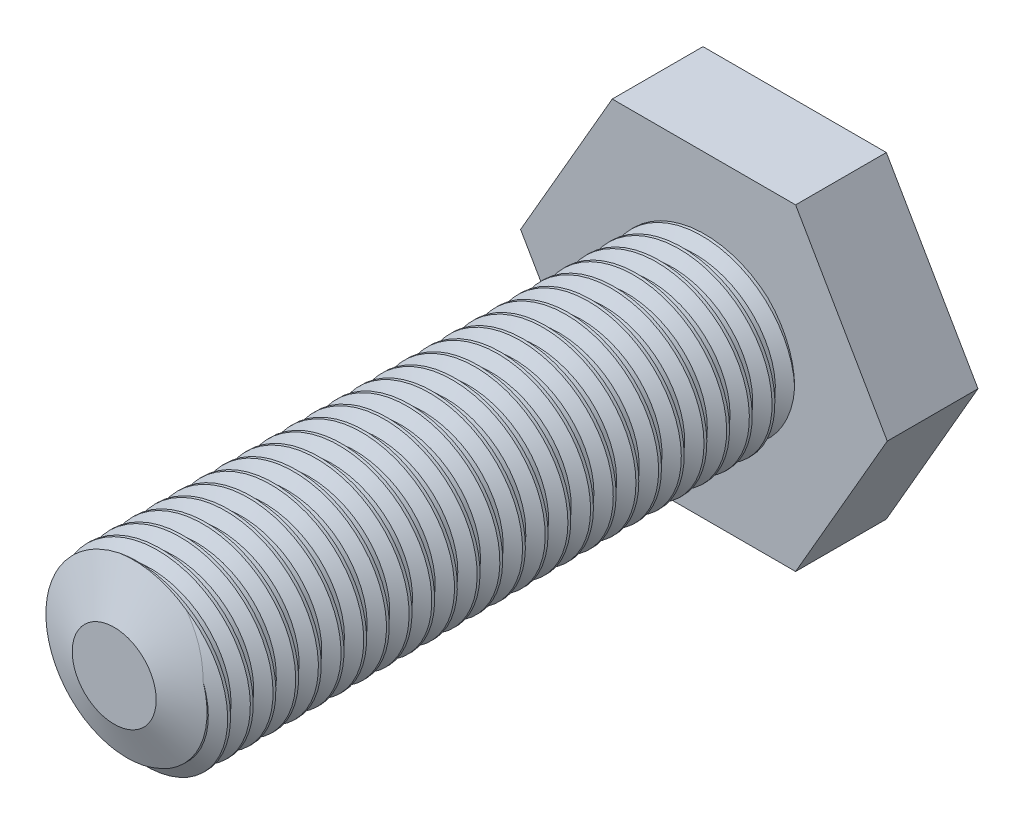
from build123d import *

# Parameters (mm, degrees)
BOSS_EXTRUDE1_DEPTH = 30
SKETCH3_OUTSIDE_W   = 25.534
SKETCH3_OUTSIDE_H   = 23.368
SKETCH3_OUTSIDE_R   = 4
CUT_EXTRUDE1_DEPTH  = 26
THREAD1_PITCH       = 1
THREAD1_FROM        = 1


with BuildPart() as part:
    # Sketch1 → Boss-Extrude1 (new body)
    with BuildSketch(Plane.XY):
        Polygon((-4.041451884, 7), (-8.082903769, 0), (-4.041451884, -7), (4.041451884, -7), (8.082903769, 0), (4.041451884, 7), align=None)
    extrude(amount=BOSS_EXTRUDE1_DEPTH)

    # Sketch3 outside → Cut-Extrude1 (cut)
    with BuildSketch(Plane.XY.offset(30)):
        Rectangle(SKETCH3_OUTSIDE_W, SKETCH3_OUTSIDE_H)
        Circle(SKETCH3_OUTSIDE_R, mode=Mode.SUBTRACT)
    extrude(amount=-CUT_EXTRUDE1_DEPTH, mode=Mode.SUBTRACT)

    # Thread1: arcs per turn and ends read off the stored shape
    # Thread1: the profile of Thread Profile1 profile screwed along a right-hand helix through 27 turns, 8 arcs to a turn; built about Z, then put on its axis
    thread1_z = Axis((0, 0, 0), (0, 0, 1))
    thread1_corners = [(4.0003, 0, -0.000173205), (4.0003, 0, 0.875173202), (3.458734125, 0, 0.562499999), (3.458734125, 0, 0.312499999)]
    with BuildLine(mode=Mode.PRIVATE) as thread1_profile:
        Line(thread1_corners[0], thread1_corners[1])
        Line(thread1_corners[1], thread1_corners[2])
        Line(thread1_corners[2], thread1_corners[3])
        Line(thread1_corners[3], thread1_corners[0])
    thread1_cap = Face(thread1_profile.wire())
    thread1_turn_angles = [0, 22.5, 45, 67.5, 90, 112.5, 135, 157.5, 180, 202.5, 225, 247.5, 270, 292.5, 315, 337.5, 360]
    thread1_turn_weights = [1, 0.9238795325112867, 1, 0.9238795325112867, 1, 0.9238795325112867, 1, 0.9238795325112867, 1, 0.9238795325112867, 1, 0.9238795325112867, 1, 0.9238795325112867, 1, 0.9238795325112867, 1]
    thread1_turn_rails = [Edge.make_bspline([Vector(p[0], p[1], 0).rotate(thread1_z, thread1_turn_angles[k]) / thread1_turn_weights[k] + Vector(0, 0, p[2] + THREAD1_PITCH * thread1_turn_angles[k] / 360) for k in range(17)], [0, 0, 0, 1, 1, 2, 2, 3, 3, 4, 4, 5, 5, 6, 6, 7, 7, 8, 8, 8], 2, thread1_turn_weights) for p in thread1_corners]
    thread1_turn_sides = [Face.make_surface_from_curves(thread1_turn_rails[p[0]], thread1_turn_rails[p[1]]) for p in [(0, 1), (1, 2), (2, 3), (3, 0)]]
    thread1 = Plane(origin=(0, 0, 3), x_dir=(1, 0, 0), z_dir=(0, 0, 1)) * split(Solid(Shell([*[p.moved(Location((0, 0, THREAD1_PITCH * i))) for i in range(27) for p in thread1_turn_sides], thread1_cap, thread1_cap.rotate(thread1_z, 9720).moved(Location((0, 0, THREAD1_PITCH * 9720 / 360)))])), bisect_by=Plane.XY.offset(THREAD1_FROM), keep=Keep.TOP, mode=Mode.PRIVATE)
    add(thread1, mode=Mode.SUBTRACT)

    # Sketch7 → Cut-Revolve1 (revolve, cut)
    with BuildSketch(Plane(origin=(0, 0, 0), x_dir=(1, 0, 0), z_dir=(0, 1, 0)), mode=Mode.PRIVATE) as cut_revolve1_sk:
        Polygon((-1.401297086, -30.177819191), (-5.013859011, -28.748673814), (-5.013859011, -30.872542638), align=None)
    revolve(cut_revolve1_sk.sketch.rotate(Axis((0, 0, -21.599206776), (0, 0, 1)), 279.139685246), axis=Axis((0, 0, -21.599206776), (0, 0, 1)), mode=Mode.SUBTRACT)


solid = part.part
